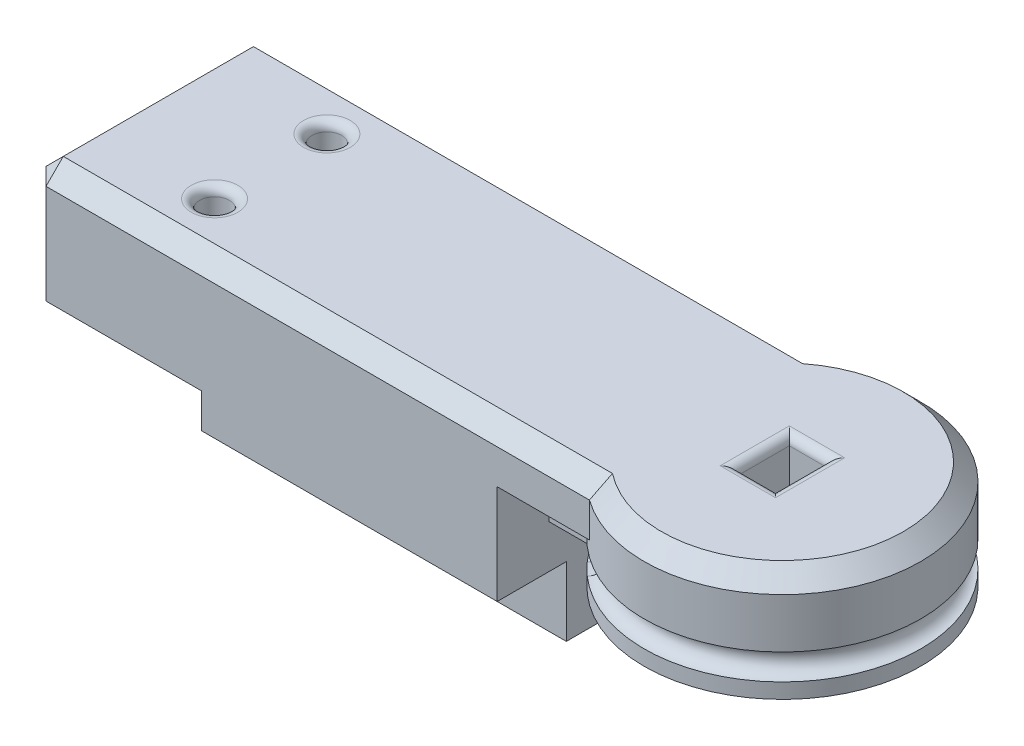
from build123d import *
from build123d.topology import SkipClean

# Parameters (mm, degrees)
SKETCH1_R               = 8
BOSS_EXTRUDE1_DEPTH     = 3.25
SKETCH3_R               = 8
SKETCH3_W               = 2.2
SKETCH3_H               = 3
BOSS_EXTRUDE2_DEPTH     = 3
BOSS_EXTRUDE3_START     = -3
SKETCH4_W               = 27.1
SKETCH4_H               = 13
BOSS_EXTRUDE3_DEPTH     = 6.75
CUT_EXTRUDE1_DEPTH      = 39.548313841
CUT_EXTRUDE1_DEPTH_BACK = 39.548313841
SKETCH5_R               = 0.85
CUT_EXTRUDE2_DEPTH      = 2.375
CUT_EXTRUDE3_REACH      = 36.846
CUT_EXTRUDE3_END_RADIUS = 0.5
SKETCH7_W               = 1
SKETCH7_H               = 1.5
CUT_EXTRUDE4_REACH      = 36.846
CUT_EXTRUDE4_END_RADIUS = 0.5
SKETCH8_W               = 1
SKETCH8_H               = 1.5
FILLET1_R               = 0.5
CHAMFER1_SIZE           = 1
BOSS_EXTRUDE4_REACH     = 40.464
SKETCH11_W              = 17.1
SKETCH11_H              = 13
BOSS_EXTRUDE5_DEPTH     = 6
SKETCH12_W              = 17.1
SKETCH12_H              = 4
CUT_EXTRUDE5_DEPTH      = 4


# Read off the part's stored shape, not the designer's step: Cut-Revolve2
with BuildPart() as part:
    # Sketch1 → Boss-Extrude1 (new body)
    with BuildSketch(Plane(origin=(0, 0, 0), x_dir=(1, 0, 0), z_dir=(0, 1, 0))):
        with Locations(Location((0, 0, 0), (0, 0, 90))):
            Circle(SKETCH1_R)
        Polygon((-1.1, 1.019803903), (-1.1, -1.019803903), (-1.1, -1.5), (1.1, -1.5), (1.1, -1.019803903), (1.1, 1.019803903), (1.1, 1.5), (-1.1, 1.5), align=None, mode=Mode.SUBTRACT)
    extrude(amount=BOSS_EXTRUDE1_DEPTH)

    # Sketch2 → Cut-Revolve1 (revolve, cut)
    with BuildSketch(Plane(origin=(0, 0, 0), x_dir=(0, 0, -1), z_dir=(1, 0, 0))):
        with BuildLine():
            Line((8, 0.875), (8, 2.375))
            ThreePointArc((8, 2.375), (7.25, 1.625), (8, 0.875))
        make_face()
    revolve(axis=Axis((0, 3.25, 0), (0, -1, 0)), mode=Mode.SUBTRACT)

    # Sketch3 → Boss-Extrude2 (add)
    # profile 1 of 2: a face of its own
    with BuildSketch(Plane(origin=(0, 3.25, 0), x_dir=(1, 0, 0), z_dir=(0, 1, 0))):
        with Locations(Location((0, 0, 0), (0, 0, 125.659087696))):
            Circle(SKETCH3_R)
        Rectangle(SKETCH3_W, SKETCH3_H, mode=Mode.SUBTRACT)
    # profile 2 of 2: a face of its own
    with BuildSketch(Plane(origin=(0, 3.25, 0), x_dir=(1, 0, 0), z_dir=(0, 1, 0))):
        with BuildLine():
            Line((-4.663689527, 6.5), (-15, 6.5))
            Line((-15, 6.5), (-15, -6.5))
            Line((-15, -6.5), (-4.663689527, -6.5))
            ThreePointArc((-4.663689527, -6.5), (-8, 0), (-4.663689527, 6.5))
        make_face()
    extrude(amount=BOSS_EXTRUDE2_DEPTH)

    # Sketch4 → Boss-Extrude3 (add)
    with BuildSketch(Plane.XZ.offset(-3.25).offset(BOSS_EXTRUDE3_START)):
        with Locations((-23.55, 0)):
            Rectangle(SKETCH4_W, SKETCH4_H)
    extrude(amount=BOSS_EXTRUDE3_DEPTH)

    # Sketch5 → Cut-Extrude1 (cut, two sides: drawn at the far end of the back side and taken through both)
    with BuildSketch(Plane(origin=(0, 6.25, 0), x_dir=(1, 0, 0), z_dir=(0, 1, 0)).offset(-CUT_EXTRUDE1_DEPTH_BACK)):
        with Locations(Location((-29.6, 3.25, 0), (0, 0, 180))):
            Circle(SKETCH5_R)
        with Locations(Location((-29.6, -3.25, 0), (0, 0, 180))):
            Circle(SKETCH5_R)
    extrude(amount=CUT_EXTRUDE1_DEPTH + CUT_EXTRUDE1_DEPTH_BACK, mode=Mode.SUBTRACT)

    # Sketch6 → Cut-Extrude2 (cut)
    with BuildSketch(Plane(origin=(0, 0, 0), x_dir=(-1, 0, 0), z_dir=(0, -1, 0))):
        with BuildLine():
            Line((3.5, -4), (3.5, 4))
            ThreePointArc((3.5, 4), (4, 4.5), (4.5, 4))
            Line((4.5, 4), (4.5, 2.704163457))
            ThreePointArc((4.5, 2.704163457), (5.25, 0), (4.5, -2.704163457))
            Line((4.5, -2.704163457), (4.5, -4))
            ThreePointArc((4.5, -4), (4, -4.5), (3.5, -4))
        make_face()
    extrude(amount=-CUT_EXTRUDE2_DEPTH, mode=Mode.SUBTRACT)

    # Cut-Extrude3: up to this cylinder (the profile starts outside it)
    cut_extrude3_end = Plane(origin=(-4, 1.625, 4), z_dir=(0, -1, 0)) * Cylinder(CUT_EXTRUDE3_END_RADIUS, 75.692, mode=Mode.PRIVATE)
    # Sketch7 → Cut-Extrude3 (cut, up to the surface)
    with BuildSketch(Plane(origin=(-5.656854249, 0, 5.656854249), x_dir=(0.707106781186546, 0, 0.7071067811865491), z_dir=(-0.7071067811865491, 0, 0.707106781186546)), mode=Mode.PRIVATE) as cut_extrude3_sk1:
        with Locations((0, 1.625)):
            Rectangle(SKETCH7_W, SKETCH7_H)
    cut_extrude3_tool1 = extrude(cut_extrude3_sk1.sketch, amount=-CUT_EXTRUDE3_REACH, mode=Mode.PRIVATE) - cut_extrude3_end
    add(cut_extrude3_tool1.solids().sort_by_distance((-5.656854, 1.625, 5.656854))[0], mode=Mode.SUBTRACT)

    # Cut-Extrude4: up to this cylinder (the profile starts outside it)
    cut_extrude4_end = Plane(origin=(-4, 1.625, -4), z_dir=(0, -1, 0)) * Cylinder(CUT_EXTRUDE4_END_RADIUS, 75.692, mode=Mode.PRIVATE)
    # Sketch8 → Cut-Extrude4 (cut, up to the surface)
    with BuildSketch(Plane(origin=(-5.656854249, 0, -5.656854249), x_dir=(0.7071067811865457, 0, -0.7071067811865493), z_dir=(0.7071067811865493, 0, 0.7071067811865457)), mode=Mode.PRIVATE) as cut_extrude4_sk1:
        with Locations((0, 1.625)):
            Rectangle(SKETCH8_W, SKETCH8_H)
    cut_extrude4_tool1 = extrude(cut_extrude4_sk1.sketch, amount=CUT_EXTRUDE4_REACH, mode=Mode.PRIVATE) - cut_extrude4_end
    add(cut_extrude4_tool1.solids().sort_by_distance((-5.656854, 1.625, -5.656854))[0], mode=Mode.SUBTRACT)

    # Fillet1
    fillet1_edges = [part.edges().sort_by_distance(p)[0] for p in [
        (1.1, 6.25, 0),
        (0, 6.25, 1.5),
        (-1.1, 6.25, 0),
        (0, 6.25, -1.5),
        (-28.75, 6.25, -3.25),
        (-28.75, -0.5, -3.25),
        (-28.75, 6.25, 3.25),
        (-28.75, -0.5, 3.25),
        (-1.1, 0, 0),
        (0, 0, 1.5),
        (1.1, 0, 0),
        (0, 0, -1.5),
    ]]
    fillet(fillet1_edges, radius=FILLET1_R)

    # Chamfer1
    chamfer1_edges = [part.edges().sort_by_distance(p)[0] for p in [
        (-20.881844763, 6.25, -6.5),
        (8, 6.25, 0),
        (-20.881844763, 6.25, 6.5),
        (-37.1, 2.875, 6.5),
        (-37.1, 6.25, 0),
        (-37.1, 2.875, -6.5),
    ]]
    chamfer(chamfer1_edges, length=CHAMFER1_SIZE)

    # Boss-Extrude4: up to this face of the body (flat: up to its plane)
    boss_extrude4_end = Plane(part.part.faces().sort_by_distance((-8.350083425, 3.25, 0))[0])
    # Sketch9 → Boss-Extrude4 (add, up to the picked face)
    with BuildSketch(Plane.XZ, mode=Mode.PRIVATE) as boss_extrude4_sk1:
        with BuildLine():
            Line((-7.193747285, -3.5), (-10, -3.5))
            Line((-10, -3.5), (-10, 3.5))
            Line((-10, 3.5), (-7.193747285, 3.5))
            ThreePointArc((-7.193747285, 3.5), (-8, 0), (-7.193747285, -3.5))
        make_face()
    boss_extrude4_tool1 = split(extrude(boss_extrude4_sk1.sketch, amount=-BOSS_EXTRUDE4_REACH, mode=Mode.PRIVATE), bisect_by=boss_extrude4_end, keep=Keep.BOTH, mode=Mode.PRIVATE)
    add(boss_extrude4_tool1.solids().sort_by(Axis((-8.85589, 0, 0), (0, 1, 0)))[0])

    # Cut-Revolve2 outline → Cut-Revolve2 (revolve, cut)
    with SkipClean():  # the faces are left unmerged after this step: merging them gives an invalid solid
        with BuildSketch(Plane.XY):
            with BuildLine():
                ThreePointArc((8, 0.875), (8.75, 1.625), (8, 2.375))
                Line((8, 2.375), (8, 0.875))
            make_face()
        revolve(axis=Axis((0, 0, 0), (0, 1, 0)), mode=Mode.SUBTRACT)

    # Sketch11 → Boss-Extrude5 (add)
    with SkipClean():  # the faces are left unmerged after this step: merging them gives an invalid solid
        with BuildSketch(Plane.XZ.offset(0.5)):
            with Locations((-18.55, 0)):
                Rectangle(SKETCH11_W, SKETCH11_H)
        extrude(amount=BOSS_EXTRUDE5_DEPTH)

    # Sketch12 → Cut-Extrude5 (cut)
    with SkipClean():  # the faces are left unmerged after this step: merging them gives an invalid solid
        with BuildSketch(Plane.XZ.offset(6.5)):
            with Locations((-18.55, -4.5)):
                Rectangle(SKETCH12_W, SKETCH12_H)
            with Locations((-18.55, 4.5)):
                Rectangle(SKETCH12_W, SKETCH12_H)
        extrude(amount=-CUT_EXTRUDE5_DEPTH, mode=Mode.SUBTRACT)


solid = part.part
